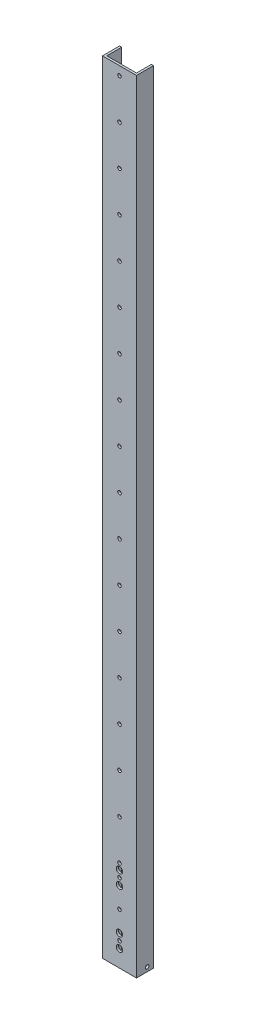
from build123d import *

# Parameters (mm, degrees)
BOSS_EXTRUDE1_DEPTH = 1168.4
IGUS_HOLES_REACH    = 1171.78
SKETCH2_R           = 2.667
CUT_EXTRUDE2_REACH  = 1171.715
SKETCH3_R           = 4.7625
SKETCH3_R_2         = 2.667
SKETCH4_R           = 2.667
CUT_EXTRUDE3_DEPTH  = 1170.77962027


with BuildPart() as part:
    # Sketch1 → Boss-Extrude1 (new body)
    with BuildSketch(Plane(origin=(0, 0, 0), x_dir=(1, 0, 0), z_dir=(0, 1, 0))):
        Polygon((3.175, 3.175), (3.175, 25.4), (0, 25.4), (0, 0), (50.8, 0), (50.8, 25.4), (47.625, 25.4), (47.625, 3.175), align=None)
    extrude(amount=BOSS_EXTRUDE1_DEPTH)

    # Sketch2 → Igus_Holes (cut, up to next)
    with BuildSketch(Plane.XY, mode=Mode.PRIVATE) as igus_holes_sk1:
        with Locations((25.4, 76.2)):
            Circle(SKETCH2_R)
    igus_holes_tool1 = extrude(igus_holes_sk1.sketch, amount=-IGUS_HOLES_REACH, mode=Mode.PRIVATE) & part.part
    # Sketch2 → Igus_Holes (cut, up to next)
    with BuildSketch(Plane.XY, mode=Mode.PRIVATE) as igus_holes_sk2:
        with Locations((25.4, 136.144)):
            Circle(SKETCH2_R)
    igus_holes_tool2 = extrude(igus_holes_sk2.sketch, amount=-IGUS_HOLES_REACH, mode=Mode.PRIVATE) & part.part
    # Sketch2 → Igus_Holes (cut, up to next)
    with BuildSketch(Plane.XY, mode=Mode.PRIVATE) as igus_holes_sk3:
        with Locations((25.4, 196.088)):
            Circle(SKETCH2_R)
    igus_holes_tool3 = extrude(igus_holes_sk3.sketch, amount=-IGUS_HOLES_REACH, mode=Mode.PRIVATE) & part.part
    # Sketch2 → Igus_Holes (cut, up to next)
    with BuildSketch(Plane.XY, mode=Mode.PRIVATE) as igus_holes_sk4:
        with Locations((25.4, 256.032)):
            Circle(SKETCH2_R)
    igus_holes_tool4 = extrude(igus_holes_sk4.sketch, amount=-IGUS_HOLES_REACH, mode=Mode.PRIVATE) & part.part
    # Sketch2 → Igus_Holes (cut, up to next)
    with BuildSketch(Plane.XY, mode=Mode.PRIVATE) as igus_holes_sk5:
        with Locations((25.4, 315.976)):
            Circle(SKETCH2_R)
    igus_holes_tool5 = extrude(igus_holes_sk5.sketch, amount=-IGUS_HOLES_REACH, mode=Mode.PRIVATE) & part.part
    # Sketch2 → Igus_Holes (cut, up to next)
    with BuildSketch(Plane.XY, mode=Mode.PRIVATE) as igus_holes_sk6:
        with Locations((25.4, 375.92)):
            Circle(SKETCH2_R)
    igus_holes_tool6 = extrude(igus_holes_sk6.sketch, amount=-IGUS_HOLES_REACH, mode=Mode.PRIVATE) & part.part
    # Sketch2 → Igus_Holes (cut, up to next)
    with BuildSketch(Plane.XY, mode=Mode.PRIVATE) as igus_holes_sk7:
        with Locations((25.4, 435.864)):
            Circle(SKETCH2_R)
    igus_holes_tool7 = extrude(igus_holes_sk7.sketch, amount=-IGUS_HOLES_REACH, mode=Mode.PRIVATE) & part.part
    # Sketch2 → Igus_Holes (cut, up to next)
    with BuildSketch(Plane.XY, mode=Mode.PRIVATE) as igus_holes_sk8:
        with Locations((25.4, 495.808)):
            Circle(SKETCH2_R)
    igus_holes_tool8 = extrude(igus_holes_sk8.sketch, amount=-IGUS_HOLES_REACH, mode=Mode.PRIVATE) & part.part
    # Sketch2 → Igus_Holes (cut, up to next)
    with BuildSketch(Plane.XY, mode=Mode.PRIVATE) as igus_holes_sk9:
        with Locations((25.4, 555.752)):
            Circle(SKETCH2_R)
    igus_holes_tool9 = extrude(igus_holes_sk9.sketch, amount=-IGUS_HOLES_REACH, mode=Mode.PRIVATE) & part.part
    # Sketch2 → Igus_Holes (cut, up to next)
    with BuildSketch(Plane.XY, mode=Mode.PRIVATE) as igus_holes_sk10:
        with Locations((25.4, 615.696)):
            Circle(SKETCH2_R)
    igus_holes_tool10 = extrude(igus_holes_sk10.sketch, amount=-IGUS_HOLES_REACH, mode=Mode.PRIVATE) & part.part
    # Sketch2 → Igus_Holes (cut, up to next)
    with BuildSketch(Plane.XY, mode=Mode.PRIVATE) as igus_holes_sk11:
        with Locations((25.4, 675.64)):
            Circle(SKETCH2_R)
    igus_holes_tool11 = extrude(igus_holes_sk11.sketch, amount=-IGUS_HOLES_REACH, mode=Mode.PRIVATE) & part.part
    # Sketch2 → Igus_Holes (cut, up to next)
    with BuildSketch(Plane.XY, mode=Mode.PRIVATE) as igus_holes_sk12:
        with Locations((25.4, 735.584)):
            Circle(SKETCH2_R)
    igus_holes_tool12 = extrude(igus_holes_sk12.sketch, amount=-IGUS_HOLES_REACH, mode=Mode.PRIVATE) & part.part
    # Sketch2 → Igus_Holes (cut, up to next)
    with BuildSketch(Plane.XY, mode=Mode.PRIVATE) as igus_holes_sk13:
        with Locations((25.4, 795.528)):
            Circle(SKETCH2_R)
    igus_holes_tool13 = extrude(igus_holes_sk13.sketch, amount=-IGUS_HOLES_REACH, mode=Mode.PRIVATE) & part.part
    # Sketch2 → Igus_Holes (cut, up to next)
    with BuildSketch(Plane.XY, mode=Mode.PRIVATE) as igus_holes_sk14:
        with Locations((25.4, 855.472)):
            Circle(SKETCH2_R)
    igus_holes_tool14 = extrude(igus_holes_sk14.sketch, amount=-IGUS_HOLES_REACH, mode=Mode.PRIVATE) & part.part
    # Sketch2 → Igus_Holes (cut, up to next)
    with BuildSketch(Plane.XY, mode=Mode.PRIVATE) as igus_holes_sk15:
        with Locations((25.4, 915.416)):
            Circle(SKETCH2_R)
    igus_holes_tool15 = extrude(igus_holes_sk15.sketch, amount=-IGUS_HOLES_REACH, mode=Mode.PRIVATE) & part.part
    # Sketch2 → Igus_Holes (cut, up to next)
    with BuildSketch(Plane.XY, mode=Mode.PRIVATE) as igus_holes_sk16:
        with Locations((25.4, 975.36)):
            Circle(SKETCH2_R)
    igus_holes_tool16 = extrude(igus_holes_sk16.sketch, amount=-IGUS_HOLES_REACH, mode=Mode.PRIVATE) & part.part
    # Sketch2 → Igus_Holes (cut, up to next)
    with BuildSketch(Plane.XY, mode=Mode.PRIVATE) as igus_holes_sk17:
        with Locations((25.4, 1035.304)):
            Circle(SKETCH2_R)
    igus_holes_tool17 = extrude(igus_holes_sk17.sketch, amount=-IGUS_HOLES_REACH, mode=Mode.PRIVATE) & part.part
    # Sketch2 → Igus_Holes (cut, up to next)
    with BuildSketch(Plane.XY, mode=Mode.PRIVATE) as igus_holes_sk18:
        with Locations((25.4, 1095.248)):
            Circle(SKETCH2_R)
    igus_holes_tool18 = extrude(igus_holes_sk18.sketch, amount=-IGUS_HOLES_REACH, mode=Mode.PRIVATE) & part.part
    # Sketch2 → Igus_Holes (cut, up to next)
    with BuildSketch(Plane.XY, mode=Mode.PRIVATE) as igus_holes_sk19:
        with Locations((25.4, 1155.192)):
            Circle(SKETCH2_R)
    igus_holes_tool19 = extrude(igus_holes_sk19.sketch, amount=-IGUS_HOLES_REACH, mode=Mode.PRIVATE) & part.part
    add(igus_holes_tool1.solids().sort_by_distance((25.4, 76.2, 0))[0], mode=Mode.SUBTRACT)
    add(igus_holes_tool2.solids().sort_by_distance((25.4, 136.144, 0))[0], mode=Mode.SUBTRACT)
    add(igus_holes_tool3.solids().sort_by_distance((25.4, 196.088, 0))[0], mode=Mode.SUBTRACT)
    add(igus_holes_tool4.solids().sort_by_distance((25.4, 256.032, 0))[0], mode=Mode.SUBTRACT)
    add(igus_holes_tool5.solids().sort_by_distance((25.4, 315.976, 0))[0], mode=Mode.SUBTRACT)
    add(igus_holes_tool6.solids().sort_by_distance((25.4, 375.92, 0))[0], mode=Mode.SUBTRACT)
    add(igus_holes_tool7.solids().sort_by_distance((25.4, 435.864, 0))[0], mode=Mode.SUBTRACT)
    add(igus_holes_tool8.solids().sort_by_distance((25.4, 495.808, 0))[0], mode=Mode.SUBTRACT)
    add(igus_holes_tool9.solids().sort_by_distance((25.4, 555.752, 0))[0], mode=Mode.SUBTRACT)
    add(igus_holes_tool10.solids().sort_by_distance((25.4, 615.696, 0))[0], mode=Mode.SUBTRACT)
    add(igus_holes_tool11.solids().sort_by_distance((25.4, 675.64, 0))[0], mode=Mode.SUBTRACT)
    add(igus_holes_tool12.solids().sort_by_distance((25.4, 735.584, 0))[0], mode=Mode.SUBTRACT)
    add(igus_holes_tool13.solids().sort_by_distance((25.4, 795.528, 0))[0], mode=Mode.SUBTRACT)
    add(igus_holes_tool14.solids().sort_by_distance((25.4, 855.472, 0))[0], mode=Mode.SUBTRACT)
    add(igus_holes_tool15.solids().sort_by_distance((25.4, 915.416, 0))[0], mode=Mode.SUBTRACT)
    add(igus_holes_tool16.solids().sort_by_distance((25.4, 975.36, 0))[0], mode=Mode.SUBTRACT)
    add(igus_holes_tool17.solids().sort_by_distance((25.4, 1035.304, 0))[0], mode=Mode.SUBTRACT)
    add(igus_holes_tool18.solids().sort_by_distance((25.4, 1095.248, 0))[0], mode=Mode.SUBTRACT)
    add(igus_holes_tool19.solids().sort_by_distance((25.4, 1155.192, 0))[0], mode=Mode.SUBTRACT)

    # Sketch3 → Cut-Extrude2 (cut, up to next)
    with BuildSketch(Plane(origin=(0, 0, -3.175), x_dir=(-1, 0, 0), z_dir=(0, 0, -1)), mode=Mode.PRIVATE) as cut_extrude2_sk1:
        with Locations((-25.4, 25.4)):
            Circle(SKETCH3_R)
    cut_extrude2_tool1 = extrude(cut_extrude2_sk1.sketch, amount=-CUT_EXTRUDE2_REACH, mode=Mode.PRIVATE) & part.part
    # Sketch3 → Cut-Extrude2 (cut, up to next)
    with BuildSketch(Plane(origin=(0, 0, -3.175), x_dir=(-1, 0, 0), z_dir=(0, 0, -1)), mode=Mode.PRIVATE) as cut_extrude2_sk2:
        with Locations((-25.4, 35.39998)):
            Circle(SKETCH3_R_2)
    cut_extrude2_tool2 = extrude(cut_extrude2_sk2.sketch, amount=-CUT_EXTRUDE2_REACH, mode=Mode.PRIVATE) & part.part
    # Sketch3 → Cut-Extrude2 (cut, up to next)
    with BuildSketch(Plane(origin=(0, 0, -3.175), x_dir=(-1, 0, 0), z_dir=(0, 0, -1)), mode=Mode.PRIVATE) as cut_extrude2_sk3:
        with Locations((-25.4, 117.00002)):
            Circle(SKETCH3_R_2)
    cut_extrude2_tool3 = extrude(cut_extrude2_sk3.sketch, amount=-CUT_EXTRUDE2_REACH, mode=Mode.PRIVATE) & part.part
    # Sketch3 → Cut-Extrude2 (cut, up to next)
    with BuildSketch(Plane(origin=(0, 0, -3.175), x_dir=(-1, 0, 0), z_dir=(0, 0, -1)), mode=Mode.PRIVATE) as cut_extrude2_sk4:
        with Locations((-25.4, 45.39996)):
            Circle(SKETCH3_R)
    cut_extrude2_tool4 = extrude(cut_extrude2_sk4.sketch, amount=-CUT_EXTRUDE2_REACH, mode=Mode.PRIVATE) & part.part
    # Sketch3 → Cut-Extrude2 (cut, up to next)
    with BuildSketch(Plane(origin=(0, 0, -3.175), x_dir=(-1, 0, 0), z_dir=(0, 0, -1)), mode=Mode.PRIVATE) as cut_extrude2_sk5:
        with Locations((-25.4, 107.00004)):
            Circle(SKETCH3_R)
    cut_extrude2_tool5 = extrude(cut_extrude2_sk5.sketch, amount=-CUT_EXTRUDE2_REACH, mode=Mode.PRIVATE) & part.part
    # Sketch3 → Cut-Extrude2 (cut, up to next)
    with BuildSketch(Plane(origin=(0, 0, -3.175), x_dir=(-1, 0, 0), z_dir=(0, 0, -1)), mode=Mode.PRIVATE) as cut_extrude2_sk6:
        with Locations((-25.4, 127)):
            Circle(SKETCH3_R)
    cut_extrude2_tool6 = extrude(cut_extrude2_sk6.sketch, amount=-CUT_EXTRUDE2_REACH, mode=Mode.PRIVATE) & part.part
    add(cut_extrude2_tool1.solids().sort_by_distance((25.4, 25.4, -3.175))[0], mode=Mode.SUBTRACT)
    add(cut_extrude2_tool2.solids().sort_by_distance((25.4, 35.39998, -3.175))[0], mode=Mode.SUBTRACT)
    add(cut_extrude2_tool3.solids().sort_by_distance((25.4, 117.00002, -3.175))[0], mode=Mode.SUBTRACT)
    add(cut_extrude2_tool4.solids().sort_by_distance((25.4, 45.39996, -3.175))[0], mode=Mode.SUBTRACT)
    add(cut_extrude2_tool5.solids().sort_by_distance((25.4, 107.00004, -3.175))[0], mode=Mode.SUBTRACT)
    add(cut_extrude2_tool6.solids().sort_by_distance((25.4, 127, -3.175))[0], mode=Mode.SUBTRACT)

    # Sketch4 → Cut-Extrude3 (cut, through all)
    with BuildSketch(Plane.ZY):
        with Locations((-15.875, 6.35)):
            Circle(SKETCH4_R)
    extrude(amount=-CUT_EXTRUDE3_DEPTH, mode=Mode.SUBTRACT)


solid = part.part
